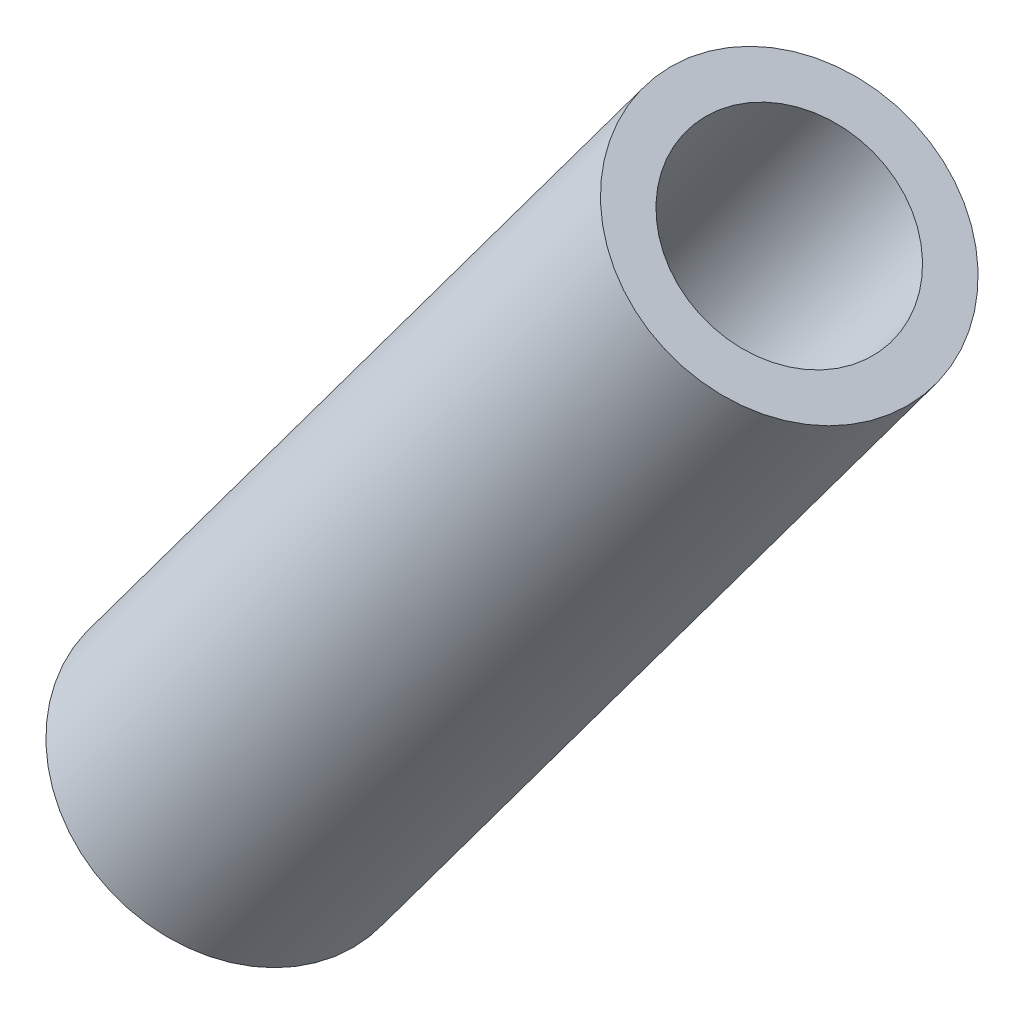
from build123d import *

# Parameters (mm, degrees)
SWEEP1_PROFILE_R     = 13.49375
CUT_SWEEP1_PROFILE_R = 9.525


with BuildPart() as part:
    # Sweep1: sweep along a curve in space
    with BuildLine() as sweep1_path:
        Line((-20.511429175, -27.615960479, 0), (30.290133782, 40.78170908, 0))
    # Sweep1 profile (on start of the path) → Sweep1 (sweep)
    with BuildSketch(Plane(origin=(-20.511429175, -27.615960479, 0), x_dir=(0.8027895488189019, -0.5962624760180234, 0), z_dir=(0.5962624760180234, 0.8027895488189019, 1.2207338630913782e-15))):
        Circle(SWEEP1_PROFILE_R)
    sweep(path=sweep1_path.line)

    # Cut-Sweep1: sweep along a curve in space
    with BuildLine() as cut_sweep1_path:
        Line((-20.511429175, -27.615960479, 0), (30.290133782, 40.78170908, 0))
    # Cut-Sweep1 profile (on start of the path) → Cut-Sweep1 (sweep, cut)
    with BuildSketch(Plane(origin=(-20.511429175, -27.615960479, 0), x_dir=(0.8027895488189019, -0.5962624760180234, 0), z_dir=(0.5962624760180234, 0.8027895488189019, 1.2207338630913782e-15))):
        Circle(CUT_SWEEP1_PROFILE_R)
    sweep(path=cut_sweep1_path.line, mode=Mode.SUBTRACT)


solid = part.part
